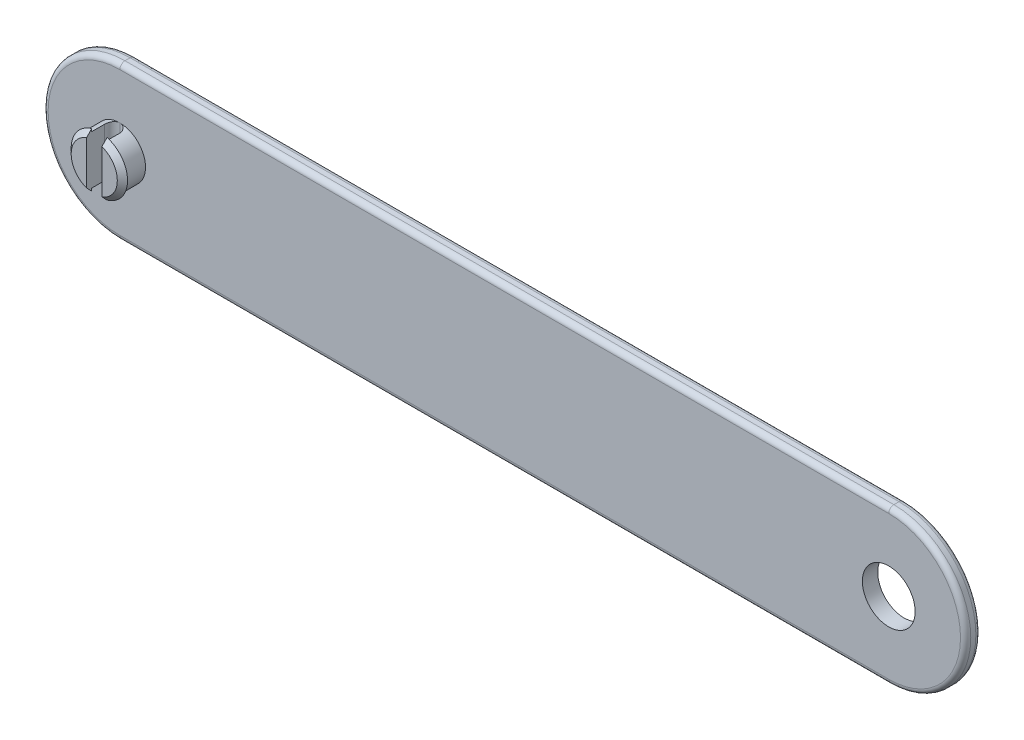
from build123d import *

# Parameters (mm, degrees)
EXTRUDE_1_DEPTH     = 3
EXTRUDE_2_DEPTH     = 4
EXTRUDE_3_DEPTH     = 1
CHAMFER_1_SIZE      = 1
SKETCH_1_3_R        = 5.15
CUT_EXTRUDE_1_DEPTH = 5
FILLET_1_R          = 1.5
FILLET_2_R          = 1


with BuildPart() as part:
    # 草图1 → 凸台-拉伸1 (new body)
    with BuildSketch(Plane.XY):
        with BuildLine():
            Line((0, 15), (150, 15))
            ThreePointArc((150, 15), (165, 0), (150, -15))
            Line((150, -15), (0, -15))
            ThreePointArc((0, -15), (-15, 0), (0, 15))
        make_face()
    extrude(amount=EXTRUDE_1_DEPTH)

    # 草图2 → 凸台-拉伸2 (add)
    with BuildSketch(Plane.XY.offset(3)):
        with BuildLine():
            Line((-1.5, 4.769696007), (-1.5, -4.769696007))
            ThreePointArc((-1.5, -4.769696007), (-5, 0), (-1.5, 4.769696007))
        make_face()
        with BuildLine():
            Line((1.5, 4.769696007), (1.5, -4.769696007))
            ThreePointArc((1.5, -4.769696007), (5, 0), (1.5, 4.769696007))
        make_face()
    extrude(amount=EXTRUDE_2_DEPTH)

    # 草图5 → 凸台-拉伸3 (add)
    with BuildSketch(Plane.XY.offset(7)):
        with BuildLine():
            Line((-1.5, 5.291502622), (-1.5, -5.291502622))
            ThreePointArc((-1.5, -5.291502622), (-5.5, 0), (-1.5, 5.291502622))
        make_face()
        with BuildLine():
            Line((1.5, 5.291502622), (1.5, -5.291502622))
            ThreePointArc((1.5, -5.291502622), (5.5, 0), (1.5, 5.291502622))
        make_face()
    extrude(amount=EXTRUDE_3_DEPTH)

    # 倒角1
    chamfer_1_edges = [part.edges().sort_by_distance(p)[0] for p in [
        (5.5, 0, 8),
        (-5.5, 0, 8),
    ]]
    chamfer(chamfer_1_edges, length=CHAMFER_1_SIZE - 0.0001)  # a hair under: the kernel refuses the full size

    # 草图1<3> → 切除-拉伸1 (cut)
    with BuildSketch(Plane.XY):
        with Locations((150, 0)):
            Circle(SKETCH_1_3_R)
    extrude(amount=CUT_EXTRUDE_1_DEPTH, mode=Mode.SUBTRACT)

    # 圆角1
    fillet_1_edges = [part.edges().sort_by_distance(p)[0] for p in [
        (-1.5, 0, 3),
        (1.5, 0, 3),
    ]]
    fillet(fillet_1_edges, radius=FILLET_1_R - 0.0001)  # a hair under: the kernel refuses the full size

    # 圆角2
    fillet_2_edges = [part.edges().sort_by_distance(p)[0] for p in [
        (165, 0, 3),
        (75, 15, 3),
        (-15, 0, 3),
        (75, 15, 0),
        (165, 0, 0),
        (75, -15, 0),
        (-15, 0, 0),
        (75, -15, 3),
    ]]
    fillet(fillet_2_edges, radius=FILLET_2_R)


solid = part.part
